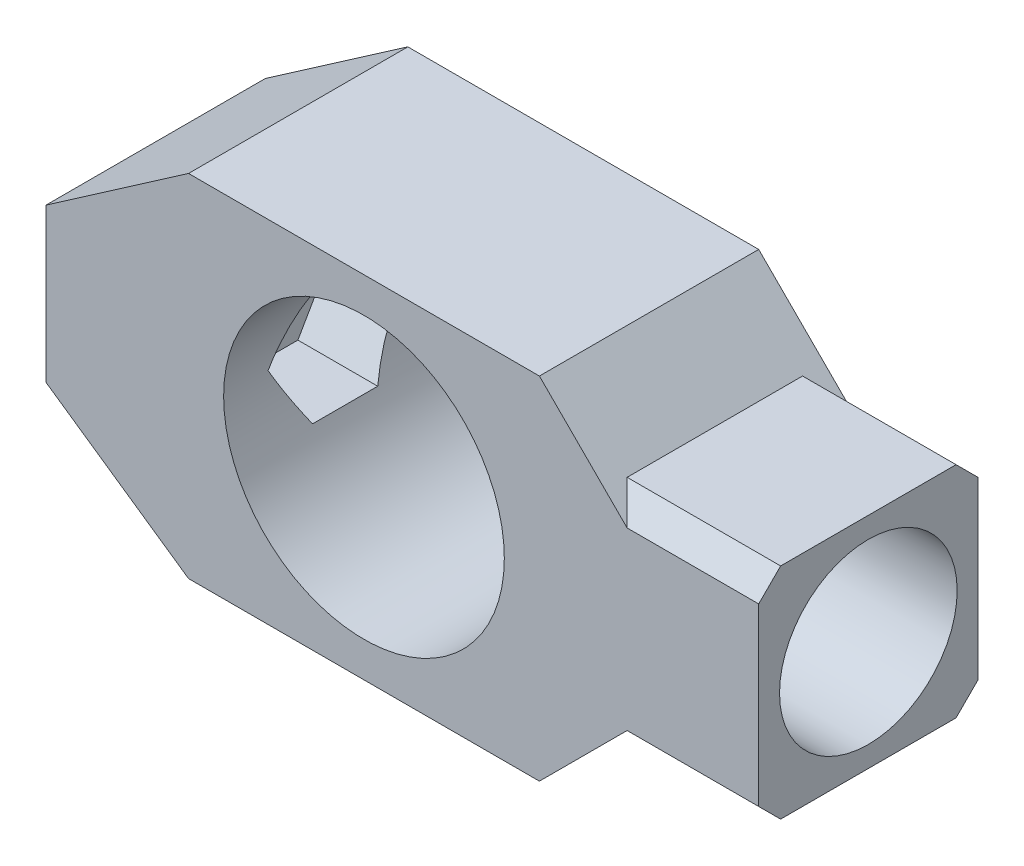
from build123d import *

# Parameters (mm, degrees)
ESQUISSE1_W                  = 32
ESQUISSE1_H                  = 32
BOSS_EXTRU_1_DEPTH           = 20
ENL_V_MAT_EXTRU_1_DEPTH      = 50.477267507
ENL_V_MAT_EXTRU_1_DEPTH_BACK = 50.477267507
ESQUISSE2_R                  = 12.8
BOSS_EXTRU_2_DEPTH           = 20
ESQUISSE4_R                  = 3.25
ENL_V_MAT_EXTRU_2_DEPTH      = 10
ENL_V_MAT_EXTRU_3_DEPTH      = 20
ESQUISSE6_W                  = 20
ESQUISSE6_H                  = 20
ESQUISSE6_R                  = 8.1
BOSS_EXTRU_3_DEPTH           = 20
CHANFREIN1_SIZE              = 6
CHANFREIN2_SIZE              = 2
ENL_V_START                  = -2
ESQUISSE7_R                  = 8.1
ENL_V_MAT_EXTRU_4_DEPTH      = 2


with BuildPart() as part:
    # Esquisse1 → Boss.-Extru.1 (new body)
    with BuildSketch(Plane.XY):
        with Locations((16, 16)):
            Rectangle(ESQUISSE1_W, ESQUISSE1_H)
    extrude(amount=BOSS_EXTRU_1_DEPTH)

    # Esquisse2 → Enlèv. mat.-Extru.1 (cut, two sides: drawn at the far end of the back side and taken through both)
    with BuildSketch(Plane.XY.offset(20).offset(-ENL_V_MAT_EXTRU_1_DEPTH_BACK)):
        with Locations((16, 16)):
            Circle(ESQUISSE2_R)
    extrude(amount=ENL_V_MAT_EXTRU_1_DEPTH + ENL_V_MAT_EXTRU_1_DEPTH_BACK, mode=Mode.SUBTRACT)

    # Esquisse3 → Boss.-Extru.2 (add)
    with BuildSketch(Plane.XY.offset(20)):
        Polygon((0, 0), (0, 32), (-13, 23), (-13, 9), align=None)
    extrude(amount=-BOSS_EXTRU_2_DEPTH)

    # Esquisse4 → Enlèv. mat.-Extru.2 (cut)
    with BuildSketch(Plane.ZY.offset(13)):
        with Locations((10, 16)):
            Circle(ESQUISSE4_R)
    extrude(amount=-ENL_V_MAT_EXTRU_2_DEPTH, mode=Mode.SUBTRACT)

    # Esquisse5 → Enlèv. mat.-Extru.3 (cut)
    with BuildSketch(Plane.ZY.offset(3)):
        Polygon((12.973353886, 10.85), (15.946707773, 16), (12.973353886, 21.15), (7.026646114, 21.15), (4.053292227, 16), (7.026646114, 10.85), align=None)
    extrude(amount=-ENL_V_MAT_EXTRU_3_DEPTH, mode=Mode.SUBTRACT)

    # Esquisse6 → Boss.-Extru.3 (add)
    with BuildSketch(Plane(origin=(32, 0, 0), x_dir=(0, 0, -1), z_dir=(1, 0, 0))):
        with Locations((-10, 16)):
            Rectangle(ESQUISSE6_W, ESQUISSE6_H)
        with Locations((-10, 16)):
            Circle(ESQUISSE6_R, mode=Mode.SUBTRACT)
    extrude(amount=BOSS_EXTRU_3_DEPTH)

    # Chanfrein1
    chanfrein1_edges = [part.edges().sort_by_distance(p)[0] for p in [
        (32, 6, 10),
        (32, 26, 10),
    ]]
    chamfer(chanfrein1_edges, length=CHANFREIN1_SIZE - 0.0001)  # a hair under: the kernel refuses the full size

    # Chanfrein2
    chanfrein2_edges = [part.edges().sort_by_distance(p)[0] for p in [
        (44.99995, 6, 20),
        (44.99995, 6, 0),
        (44.99995, 26, 0),
        (44.99995, 26, 20),
    ]]
    chamfer(chanfrein2_edges, length=CHANFREIN2_SIZE)

    # Esquisse7 → Enlèv. mat.-Extru.4 (cut)
    with BuildSketch(Plane(origin=(32, 0, 0), x_dir=(0, 0, -1), z_dir=(1, 0, 0)).offset(ENL_V_START)):
        with Locations((-10, 16)):
            Circle(ESQUISSE7_R)
    extrude(amount=ENL_V_MAT_EXTRU_4_DEPTH, mode=Mode.SUBTRACT)


solid = part.part
